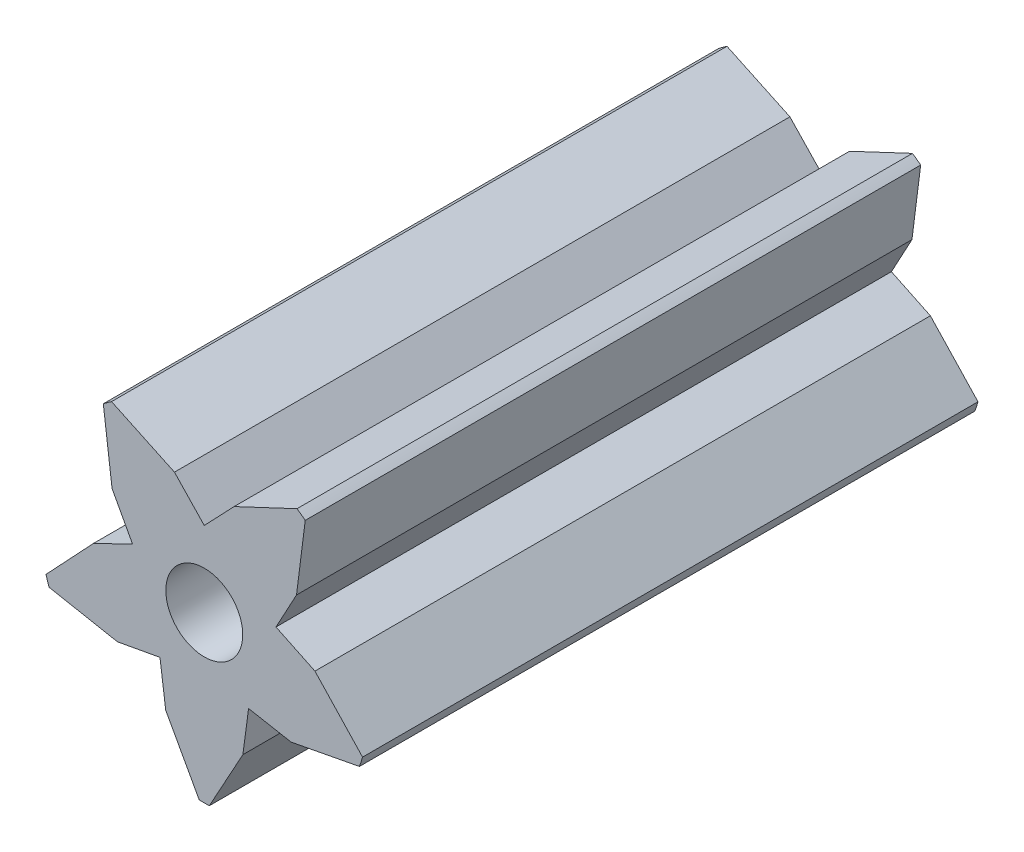
from build123d import *

# Parameters (mm, degrees)
SKETCH1_R           = 7.5
SKETCH1_R_2         = 1.75
BOSS_EXTRUDE1_DEPTH = 28
CUT_EXTRUDE1_DEPTH  = 30.941609843
CIRPATTERN1_COUNT   = 5


with BuildPart() as part:
    # Sketch1 → Boss-Extrude1 (new body)
    with BuildSketch(Plane.XY):
        Circle(SKETCH1_R)
        Circle(SKETCH1_R_2, mode=Mode.SUBTRACT)
    extrude(amount=BOSS_EXTRUDE1_DEPTH)

    # Sketch2 → Cut-Extrude1 (cut, through all)
    with BuildSketch(Plane.XY):
        Polygon((0, 3.429306859), (-1.35645876, 4.852854397), (-4.219139018, 6.200714954), (0, 11.25164702), (4.219139018, 6.200714954), (1.35645876, 4.852854397), align=None)
    cut_extrude1 = extrude(amount=CUT_EXTRUDE1_DEPTH, mode=Mode.SUBTRACT)

    # CirPattern1: Cut-Extrude1 ×5 about axis
    cirpattern1_axis = Axis((0, 0, 28), (0, 0, -1))
    for i in range(1, CIRPATTERN1_COUNT):
        add(cut_extrude1.rotate(cirpattern1_axis, i * 360 / CIRPATTERN1_COUNT), mode=Mode.SUBTRACT)


solid = part.part
